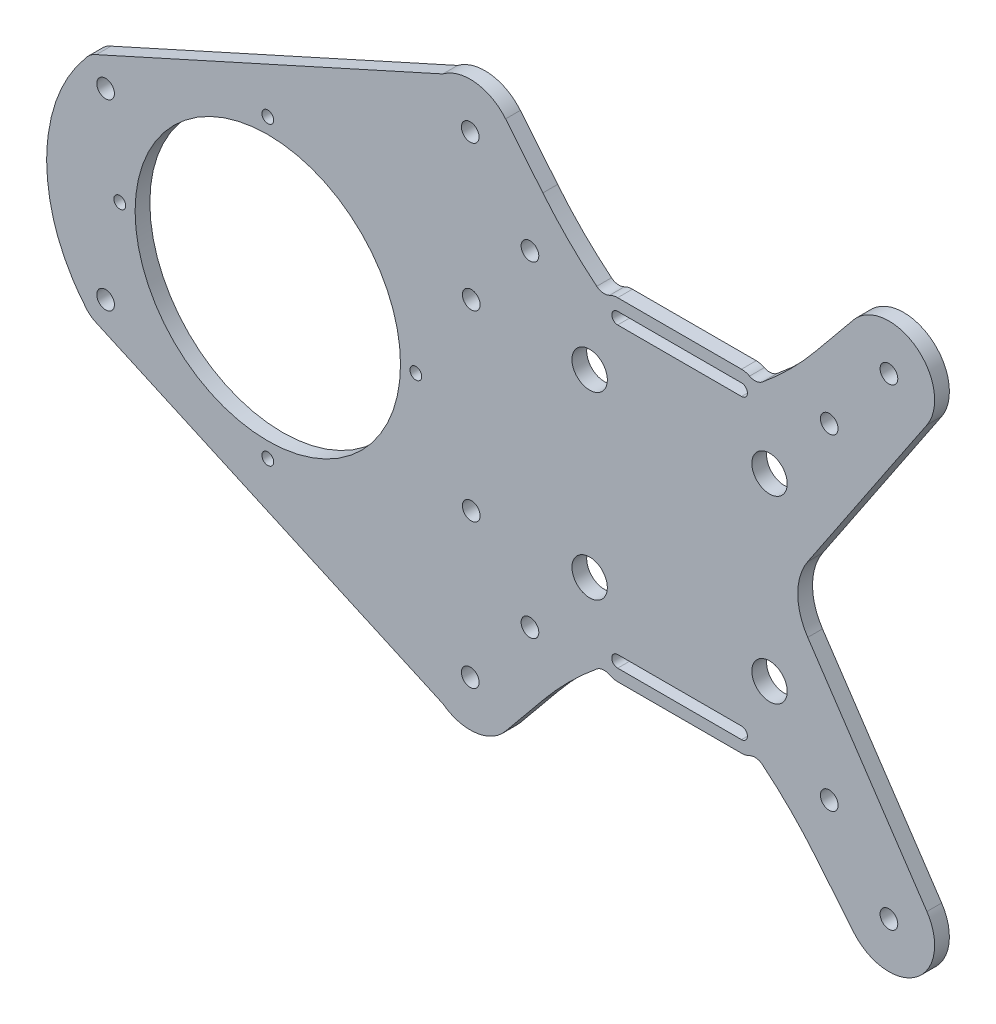
from build123d import *

# Parameters (mm, degrees)
CROQUIS1_R              = 2.25
CROQUIS1_R_2            = 3
CROQUIS1_R_3            = 1.5
CROQUIS1_R_4            = 2.249997567
SALIENTE_EXTRUIR1_DEPTH = 2.5
SALIENTE_EXTRUIR3_START = -2.5
CROQUIS6_R              = 2.250000066
CROQUIS6_R_2            = 1.5
CROQUIS6_R_3            = 2.25
SALIENTE_EXTRUIR3_DEPTH = 2.5
CROQUIS5_R              = 22.5
CROQUIS5_R_2            = 1
CORTAR_EXTRUIR5_DEPTH   = 2.5


with BuildPart() as part:
    # Croquis1 → Saliente-Extruir1 (new body)
    with BuildSketch(Plane.XY):
        with BuildLine():
            Line((-29.502526327, -44.949972179), (-23.17778065, -37.243838032))
            ThreePointArc((-23.17778065, -37.243838032), (-18.839723212, -32.444384768), (-14.046056443, -28.099933953))
            ThreePointArc((-14.046056443, -28.099933953), (-12.991422185, -27.658257217), (-11.867164621, -27.866527921))
            ThreePointArc((-11.867164621, -27.866527921), (-11.203313373, -28.112469078), (-10.500314, -28.196))
            Line((-10.500314, -28.196), (10.499686, -28.196))
            ThreePointArc((10.499686, -28.196), (11.203007921, -28.112542722), (11.867164264, -27.866528101))
            ThreePointArc((11.867164264, -27.866528101), (12.991422421, -27.658256674), (14.046057406, -28.099933523))
            ThreePointArc((14.046057406, -28.099933523), (18.839775902, -32.444337151), (23.177889012, -37.243749049))
            Line((23.177889012, -37.243749049), (29.502526012, -44.949972049))
            ThreePointArc((29.502526012, -44.949972049), (40.113877497, -46.255199126), (41.931739547, -35.719556022))
            Line((41.931739547, -35.719556022), (21.72923101, -5.566101046))
            ThreePointArc((21.72923101, -5.566101046), (20.036969431, -9.5e-08), (21.729230693, 5.566100954))
            Line((21.729230693, 5.566100954), (41.931739693, 35.719555954))
            ThreePointArc((41.931739693, 35.719555954), (40.113877277, 46.255198335), (29.502526336, 44.949972165))
            Line((29.502526336, 44.949972165), (23.17778065, 37.243838007))
            ThreePointArc((23.17778065, 37.243838007), (18.839723212, 32.444384742), (14.046056443, 28.099933927))
            ThreePointArc((14.046056443, 28.099933927), (12.991421988, 27.658257139), (11.867164252, 27.866528027))
            ThreePointArc((11.867164252, 27.866528027), (11.203313175, 28.112469073), (10.500314, 28.195999974))
            Line((10.500314, 28.195999974), (-10.500314, 28.195999974))
            ThreePointArc((-10.500314, 28.195999974), (-11.203313178, 28.112469098), (-11.867164264, 27.866528075))
            ThreePointArc((-11.867164264, 27.866528075), (-12.991422421, 27.658256648), (-14.046057406, 28.099933497))
            ThreePointArc((-14.046057406, 28.099933497), (-18.839775902, 32.444337126), (-23.177889012, 37.243749023))
            Line((-23.177889012, 37.243749023), (-29.502526012, 44.949972023))
            ThreePointArc((-29.502526012, 44.949972023), (-40.146302424, 46.230987494), (-41.886340556, 35.652554517))
            ThreePointArc((-41.886340556, 35.652554517), (-41.288874902, 25.337679941), (-50.13550001, 20.000000021))
            Line((-50.13550001, 20.000000021), (-97.31807601, 20.000000021))
            ThreePointArc((-97.31807601, 20.000000021), (-99.1994919, 19.554558541), (-100.681450855, 18.312809163))
            add(Edge.make_bspline(
                [(-107.31807554, 2.1e-08), (-107.252414123, 7.059743944), (-104.975710329, 13.164639039), (-100.681450855, 18.312809163)],
                knots=[0, 0, 0, 0, 1, 1, 1, 1], degree=3))
            add(Edge.make_bspline(
                [(-107.31807554, 2.1e-08), (-107.252414123, -7.059743902), (-104.975710329, -13.164638997), (-100.681450855, -18.312809121)],
                knots=[0, 0, 0, 0, 1, 1, 1, 1], degree=3))
            ThreePointArc((-100.681450855, -18.312809121), (-99.19949186, -19.554558345), (-97.31807601, -19.9999997))
            Line((-97.31807601, -19.9999997), (-50.13550001, -19.9999997))
            ThreePointArc((-50.13550001, -19.9999997), (-41.288874902, -25.33767962), (-41.886340556, -35.652554196))
            ThreePointArc((-41.886340556, -35.652554196), (-40.146302646, -46.230987042), (-29.502526327, -44.949972179))
        make_face()
        with Locations((-25.371621, 27.641642)):
            Circle(CROQUIS1_R, mode=Mode.SUBTRACT)
        with Locations((-35.493242035, 40.033284004)):
            Circle(CROQUIS1_R, mode=Mode.SUBTRACT)
        with Locations((-35.49324201, -40.0332837)):
            Circle(CROQUIS1_R, mode=Mode.SUBTRACT)
        with Locations((15.25, -15.25)):
            Circle(CROQUIS1_R_2, mode=Mode.SUBTRACT)
        with Locations((35.493242035, -40.03328403)):
            Circle(CROQUIS1_R, mode=Mode.SUBTRACT)
        with Locations((-15.25, 15.25)):
            Circle(CROQUIS1_R_2, mode=Mode.SUBTRACT)
        with Locations((-25.371621, -27.641642)):
            Circle(CROQUIS1_R, mode=Mode.SUBTRACT)
        with Locations((-35.318076, 15.5)):
            Circle(CROQUIS1_R_3, mode=Mode.SUBTRACT)
        with Locations((25.371621, -27.641642)):
            Circle(CROQUIS1_R, mode=Mode.SUBTRACT)
        with Locations((-15.25, -15.25)):
            Circle(CROQUIS1_R_2, mode=Mode.SUBTRACT)
        with Locations((-97.318076, 15.5)):
            Circle(CROQUIS1_R_3, mode=Mode.SUBTRACT)
        with Locations((15.25, 15.25)):
            Circle(CROQUIS1_R_2, mode=Mode.SUBTRACT)
        with Locations((-35.318076, -15.5)):
            Circle(CROQUIS1_R_3, mode=Mode.SUBTRACT)
        with Locations((25.371621, 27.641642)):
            Circle(CROQUIS1_R, mode=Mode.SUBTRACT)
        with Locations((-97.318076, -15.5)):
            Circle(CROQUIS1_R_3, mode=Mode.SUBTRACT)
        with Locations((35.493241695, 40.03328329)):
            Circle(CROQUIS1_R_4, mode=Mode.SUBTRACT)
        with BuildLine():
            Line((10.499686, -24.196), (-10.500314, -24.196))
            ThreePointArc((-10.500314, -24.196), (-11.500314, -25.196), (-10.500314, -26.196))
            Line((-10.500314, -26.196), (10.499686, -26.196))
            ThreePointArc((10.499686, -26.196), (11.499686, -25.196), (10.499686, -24.196))
        make_face(mode=Mode.SUBTRACT)
        with BuildLine():
            Line((10.499686, 24.196), (-10.500314, 24.196))
            ThreePointArc((-10.500314, 24.196), (-11.500314, 25.196), (-10.500314, 26.196))
            Line((-10.500314, 26.196), (10.499686, 26.196))
            ThreePointArc((10.499686, 26.196), (11.499686, 25.196), (10.499686, 24.196))
        make_face(mode=Mode.SUBTRACT)
    extrude(amount=SALIENTE_EXTRUIR1_DEPTH)


with BuildPart() as saliente_extruir3_tool:
    # Croquis6 → Saliente-Extruir3 (new body)
    # profile 1 of 10: a face of its own
    with BuildSketch(Plane.XY.offset(2.5).offset(SALIENTE_EXTRUIR3_START)):
        with Locations((-35.493242163, 40.033284025)):
            Circle(CROQUIS6_R)
        with Locations((-35.493242163, 40.033284025)):
            Circle(CROQUIS6_R_2, mode=Mode.SUBTRACT)
    # profile 2 of 10: a face of its own
    with BuildSketch(Plane.XY.offset(2.5).offset(SALIENTE_EXTRUIR3_START)):
        with Locations((-25.371621, 27.641642)):
            Circle(CROQUIS6_R_3)
        with Locations((-25.371621, 27.641642)):
            Circle(CROQUIS6_R_2, mode=Mode.SUBTRACT)
    # profile 3 of 10: a face of its own
    with BuildSketch(Plane.XY.offset(2.5).offset(SALIENTE_EXTRUIR3_START)):
        with Locations((25.371621, 27.641642)):
            Circle(CROQUIS6_R_3)
        with Locations(Location((25.371621, 27.641642, 0), (0, 0, 180))):
            Circle(CROQUIS6_R_2, mode=Mode.SUBTRACT)
    # profile 4 of 10: a face of its own
    with BuildSketch(Plane.XY.offset(2.5).offset(SALIENTE_EXTRUIR3_START)):
        with Locations((35.493242163, 40.033284025)):
            Circle(CROQUIS6_R)
        with Locations(Location((35.493242163, 40.033284025, 0), (0, 0, 180))):
            Circle(CROQUIS6_R_2, mode=Mode.SUBTRACT)
    # profile 5 of 10: a face of its own
    with BuildSketch(Plane.XY.offset(2.5).offset(SALIENTE_EXTRUIR3_START)):
        with Locations((35.493242163, -40.033284025)):
            Circle(CROQUIS6_R)
        with Locations((35.493242163, -40.033284025)):
            Circle(CROQUIS6_R_2, mode=Mode.SUBTRACT)
    # profile 6 of 10: a face of its own
    with BuildSketch(Plane.XY.offset(2.5).offset(SALIENTE_EXTRUIR3_START)):
        with Locations((25.371621, -27.641642)):
            Circle(CROQUIS6_R_3)
        with Locations((25.371621, -27.641642)):
            Circle(CROQUIS6_R_2, mode=Mode.SUBTRACT)
    # profile 7 of 10: a face of its own
    with BuildSketch(Plane.XY.offset(2.5).offset(SALIENTE_EXTRUIR3_START)):
        with Locations((-25.371621, -27.641642)):
            Circle(CROQUIS6_R_3)
        with Locations(Location((-25.371621, -27.641642, 0), (0, 0, 180))):
            Circle(CROQUIS6_R_2, mode=Mode.SUBTRACT)
    # profile 8 of 10: a face of its own
    with BuildSketch(Plane.XY.offset(2.5).offset(SALIENTE_EXTRUIR3_START)):
        with Locations((-35.493242163, -40.033284025)):
            Circle(CROQUIS6_R)
        with Locations(Location((-35.493242163, -40.033284025, 0), (0, 0, 180))):
            Circle(CROQUIS6_R_2, mode=Mode.SUBTRACT)
    # profile 9 of 10: a face of its own
    with BuildSketch(Plane.XY.offset(2.5).offset(SALIENTE_EXTRUIR3_START)):
        with BuildLine():
            Line((-99.1994919, 19.554558541), (-40.146302424, 46.230987494))
            ThreePointArc((-40.146302424, 46.230987494), (-43.140478024, 41.291171845), (-41.886340556, 35.652554517))
            ThreePointArc((-41.886340556, 35.652554517), (-41.288875033, 25.33768001), (-50.13550001, 20.000000021))
            Line((-50.13550001, 20.000000021), (-97.31807601, 20.000000021))
            ThreePointArc((-97.31807601, 20.000000021), (-98.214581153, 19.590579436), (-99.1994919, 19.554558541))
        make_face()
    # profile 10 of 10: a face of its own
    with BuildSketch(Plane.XY.offset(2.5).offset(SALIENTE_EXTRUIR3_START)):
        with BuildLine():
            Line((-50.13550001, -20.000000021), (-97.31807601, -20.000000021))
            ThreePointArc((-97.31807601, -20.000000021), (-98.214581153, -19.590579436), (-99.1994919, -19.554558541))
            Line((-99.1994919, -19.554558541), (-40.146302424, -46.230987494))
            ThreePointArc((-40.146302424, -46.230987494), (-43.140478024, -41.291171845), (-41.886340556, -35.652554517))
            ThreePointArc((-41.886340556, -35.652554517), (-41.288875033, -25.33768001), (-50.13550001, -20.000000021))
        make_face()
    extrude(amount=SALIENTE_EXTRUIR3_DEPTH)


with BuildPart() as part_1:
    add(part.part)


with BuildPart() as part_2:
    # Saliente-Extruir3: joined with saliente_extruir3_tool
    add(part_1.part.fuse(saliente_extruir3_tool.part, tol=0.00001))

    # Croquis5 → Cortar-Extruir5 (cut)
    with BuildSketch(Plane.XY.offset(2.5)):
        with Locations((-69.81807554, 2.1e-08)):
            Circle(CROQUIS5_R)
        with Locations((-44.71807554, 2.1e-08)):
            Circle(CROQUIS5_R_2)
        with Locations((-69.81807554, -25.099999979)):
            Circle(CROQUIS5_R_2)
        with Locations((-94.91807554, 2.1e-08)):
            Circle(CROQUIS5_R_2)
        with Locations((-69.81807554, 25.100000021)):
            Circle(CROQUIS5_R_2)
    extrude(amount=-CORTAR_EXTRUIR5_DEPTH, mode=Mode.SUBTRACT)


solid = part_2.part
